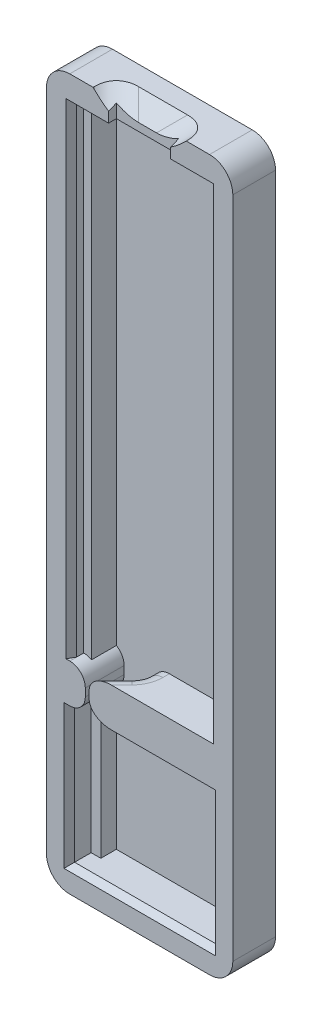
from build123d import *

# Parameters (mm, degrees)
BOSS_EXTRUDE1_DEPTH          = 5.5
SKETCH4_W                    = 16
SKETCH4_H                    = 62.5
SKETCH4_H_2                  = 18
CUT_EXTRUDE1_DEPTH           = 5
SKETCH5_W                    = 18.5
SKETCH5_H                    = 18
CUT_EXTRUDE2_DEPTH           = 3
SKETCH7_W                    = 18
SKETCH7_H                    = 62.5
CUT_EXTRUDE3_DEPTH           = 1.8
CUT_EXTRUDE4_START           = -1
SKETCH10_W                   = 8
SKETCH10_H                   = 1
CUT_EXTRUDE4_DEPTH           = 89.479047827
CUT_EXTRUDE4_TAPER           = -45
CUT_EXTRUDE4_OTHER_WAY_DEPTH = 1.8
FILLET1_R                    = 4
CHAMFER1_SIZE                = 0.5
CHAMFER1_SIZE2               = 0.866025404
CUT_EXTRUDE5_REACH           = 68.817
FILLET2_R                    = 2
FILLET3_R                    = 2


with BuildPart() as part:
    # Sketch2 → Boss-Extrude1 (new body)
    with BuildSketch(Plane.XY):
        with BuildLine():
            Line((-9, 75.5), (9, 75.5))
            ThreePointArc((9, 75.5), (11.121320344, 74.621320344), (12, 72.5))
            Line((12, 72.5), (12, -13))
            ThreePointArc((12, -13), (11.121320344, -15.121320344), (9, -16))
            Line((9, -16), (-9, -16))
            ThreePointArc((-9, -16), (-11.121320344, -15.121320344), (-12, -13))
            Line((-12, -13), (-12, 72.5))
            ThreePointArc((-12, 72.5), (-11.121320344, 74.621320344), (-9, 75.5))
        make_face()
    extrude(amount=BOSS_EXTRUDE1_DEPTH)

    # Sketch4 → Cut-Extrude1 (cut)
    with BuildSketch(Plane.XY.offset(5.5)):
        with Locations((0, 41.25)):
            Rectangle(SKETCH4_W, SKETCH4_H)
        with Locations((0, -4)):
            Rectangle(SKETCH4_W, SKETCH4_H_2)
    extrude(amount=-CUT_EXTRUDE1_DEPTH, mode=Mode.SUBTRACT)

    # Sketch5 → Cut-Extrude2 (cut)
    with BuildSketch(Plane.XY.offset(5.5)):
        with Locations((0, -4)):
            Rectangle(SKETCH5_W, SKETCH5_H)
    extrude(amount=-CUT_EXTRUDE2_DEPTH, mode=Mode.SUBTRACT)

    # Sketch7 → Cut-Extrude3 (cut)
    with BuildSketch(Plane.XY.offset(5.5)):
        with Locations((0, 41.25)):
            Rectangle(SKETCH7_W, SKETCH7_H)
    extrude(amount=-CUT_EXTRUDE3_DEPTH, mode=Mode.SUBTRACT)

    # Sketch10 → Cut-Extrude4 (cut)
    with BuildSketch(Plane.XZ.offset(-72.5).offset(CUT_EXTRUDE4_START)):
        with Locations((0, 5)):
            Rectangle(SKETCH10_W, SKETCH10_H)
    extrude(amount=-CUT_EXTRUDE4_DEPTH, taper=CUT_EXTRUDE4_TAPER, mode=Mode.SUBTRACT)

    # Sketch10 → Cut-Extrude4 other way (cut)
    with BuildSketch(Plane.XZ.offset(-72.5).offset(CUT_EXTRUDE4_START)):
        with Locations((0, 5)):
            Rectangle(SKETCH10_W, SKETCH10_H)
    extrude(amount=CUT_EXTRUDE4_OTHER_WAY_DEPTH, mode=Mode.SUBTRACT)

    # Fillet1
    # the kernel refuses this fillet: 4 mm, written as the material it adds along each edge
    with BuildSketch(Plane(origin=(0.666666667, 70.166666667, 7.833333333), x_dir=(0.4082482904638629, 0.40824829046386407, 0.8164965809277255), z_dir=(0.5773502691896267, 0.5773502691896242, -0.5773502691896265))) as fillet1_piece_1_section:
        with BuildLine():
            CenterArc((FILLET1_R * 0.57735026919, -FILLET1_R), FILLET1_R, 90, 60)
            Line((-FILLET1_R * 0.288675134595, -FILLET1_R * 0.5), (0, 0))
            Line((0, 0), (FILLET1_R * 0.57735026919, 0))
        make_face()
    fillet1_piece_1 = extrude(amount=15.011106999, mode=Mode.PRIVATE)
    fillet1_piece_1 = split(fillet1_piece_1, bisect_by=Plane(origin=(0.666666667, 75.5, 7.833333333), z_dir=(0, -1, 0)), keep=Keep.TOP, mode=Mode.PRIVATE)
    fillet1_piece_1 = split(fillet1_piece_1, bisect_by=Plane(origin=(4, 70.166666667, 7.833333333), z_dir=(-1, 0, 0)), keep=Keep.TOP, mode=Mode.PRIVATE)
    fillet1_piece_1 = split(fillet1_piece_1, bisect_by=Plane(origin=(0.666666667, 70.166666667, 4.5), z_dir=(0, 0, -1)), keep=Keep.TOP, mode=Mode.PRIVATE)
    add(fillet1_piece_1)
    with BuildSketch(Plane(origin=(0.666666667, 70.166666667, 7.833333333), x_dir=(0.4082482904638629, 0.40824829046386407, 0.8164965809277255), z_dir=(0.5773502691896267, 0.5773502691896242, -0.5773502691896265))) as fillet1_piece_2_section:
        with BuildLine():
            CenterArc((FILLET1_R * 0.57735026919, -FILLET1_R), FILLET1_R, 90, 60)
            Line((-FILLET1_R * 0.288675134595, -FILLET1_R * 0.5), (0, 0))
            Line((0, 0), (FILLET1_R * 0.57735026919, 0))
        make_face()
    fillet1_piece_2 = extrude(amount=15.011106999, mode=Mode.PRIVATE)
    fillet1_piece_2 = split(fillet1_piece_2, bisect_by=Plane(origin=(0.666666667, 75.5, 7.833333333), z_dir=(0, -1, 0)), keep=Keep.TOP, mode=Mode.PRIVATE)
    fillet1_piece_2 = split(fillet1_piece_2, bisect_by=Plane(origin=(0.666666667, 70.166666667, 5.5), z_dir=(0, 0, -1)), keep=Keep.TOP, mode=Mode.PRIVATE)
    fillet1_piece_2 = split(fillet1_piece_2, bisect_by=Plane(origin=(4, 70.166666667, 7.833333333), z_dir=(1, 0, 0)), keep=Keep.TOP, mode=Mode.PRIVATE)
    fillet1_piece_2 = split(fillet1_piece_2, bisect_by=Plane(origin=(0.666666667, 70.166666667, 4.5), z_dir=(0, 0, 1)), keep=Keep.TOP, mode=Mode.PRIVATE)
    add(fillet1_piece_2)
    with BuildSketch(Plane(origin=(0.666666667, 70.166666667, 7.833333333), x_dir=(0.4082482904638629, 0.40824829046386407, 0.8164965809277255), z_dir=(0.5773502691896267, 0.5773502691896242, -0.5773502691896265))) as fillet1_piece_3_section:
        with BuildLine():
            CenterArc((FILLET1_R * 0.57735026919, -FILLET1_R), FILLET1_R, 90, 60)
            Line((-FILLET1_R * 0.288675134595, -FILLET1_R * 0.5), (0, 0))
            Line((0, 0), (FILLET1_R * 0.57735026919, 0))
        make_face()
    fillet1_piece_3 = extrude(amount=15.011106999, mode=Mode.PRIVATE)
    fillet1_piece_3 = split(fillet1_piece_3, bisect_by=Plane(origin=(0.666666667, 75.5, 7.833333333), z_dir=(0, -1, 0)), keep=Keep.TOP, mode=Mode.PRIVATE)
    fillet1_piece_3 = split(fillet1_piece_3, bisect_by=Plane(origin=(4, 70.166666667, 7.833333333), z_dir=(1, 0, 0)), keep=Keep.TOP, mode=Mode.PRIVATE)
    fillet1_piece_3 = split(fillet1_piece_3, bisect_by=Plane(origin=(0.666666667, 70.166666667, 4.5), z_dir=(0, 0, -1)), keep=Keep.TOP, mode=Mode.PRIVATE)
    add(fillet1_piece_3)
    with BuildSketch(Plane(origin=(-0.666666667, 70.166666667, 7.833333333), x_dir=(0.8164965809277253, 0.40824829046386424, -0.4082482904638631), z_dir=(-0.5773502691896267, 0.5773502691896242, -0.5773502691896265))) as fillet1_piece_4_section:
        with BuildLine():
            CenterArc((FILLET1_R * 0.57735026919, -FILLET1_R), FILLET1_R, 90, 60)
            Line((-FILLET1_R * 0.288675134595, -FILLET1_R * 0.5), (0, 0))
            Line((0, 0), (FILLET1_R * 0.57735026919, 0))
        make_face()
    fillet1_piece_4 = extrude(amount=15.011106999, mode=Mode.PRIVATE)
    fillet1_piece_4 = split(fillet1_piece_4, bisect_by=Plane(origin=(-0.666666667, 75.5, 7.833333333), z_dir=(0, -1, 0)), keep=Keep.TOP, mode=Mode.PRIVATE)
    fillet1_piece_4 = split(fillet1_piece_4, bisect_by=Plane(origin=(-0.666666667, 70.166666667, 5.5), z_dir=(0, 0, -1)), keep=Keep.TOP, mode=Mode.PRIVATE)
    fillet1_piece_4 = split(fillet1_piece_4, bisect_by=Plane(origin=(-0.666666667, 70.166666667, 4.5), z_dir=(0, 0, 1)), keep=Keep.TOP, mode=Mode.PRIVATE)
    fillet1_piece_4 = split(fillet1_piece_4, bisect_by=Plane(origin=(-4, 70.166666667, 7.833333333), z_dir=(-1, 0, 0)), keep=Keep.TOP, mode=Mode.PRIVATE)
    add(fillet1_piece_4)
    with BuildSketch(Plane(origin=(-0.666666667, 70.166666667, 7.833333333), x_dir=(0.8164965809277253, 0.40824829046386424, -0.4082482904638631), z_dir=(-0.5773502691896267, 0.5773502691896242, -0.5773502691896265))) as fillet1_piece_5_section:
        with BuildLine():
            CenterArc((FILLET1_R * 0.57735026919, -FILLET1_R), FILLET1_R, 90, 60)
            Line((-FILLET1_R * 0.288675134595, -FILLET1_R * 0.5), (0, 0))
            Line((0, 0), (FILLET1_R * 0.57735026919, 0))
        make_face()
    fillet1_piece_5 = extrude(amount=15.011106999, mode=Mode.PRIVATE)
    fillet1_piece_5 = split(fillet1_piece_5, bisect_by=Plane(origin=(-0.666666667, 75.5, 7.833333333), z_dir=(0, -1, 0)), keep=Keep.TOP, mode=Mode.PRIVATE)
    fillet1_piece_5 = split(fillet1_piece_5, bisect_by=Plane(origin=(-0.666666667, 70.166666667, 4.5), z_dir=(0, 0, -1)), keep=Keep.TOP, mode=Mode.PRIVATE)
    fillet1_piece_5 = split(fillet1_piece_5, bisect_by=Plane(origin=(-4, 70.166666667, 7.833333333), z_dir=(1, 0, 0)), keep=Keep.TOP, mode=Mode.PRIVATE)
    add(fillet1_piece_5)
    with BuildSketch(Plane(origin=(-0.666666667, 70.166666667, 7.833333333), x_dir=(0.8164965809277253, 0.40824829046386424, -0.4082482904638631), z_dir=(-0.5773502691896267, 0.5773502691896242, -0.5773502691896265))) as fillet1_piece_6_section:
        with BuildLine():
            CenterArc((FILLET1_R * 0.57735026919, -FILLET1_R), FILLET1_R, 90, 60)
            Line((-FILLET1_R * 0.288675134595, -FILLET1_R * 0.5), (0, 0))
            Line((0, 0), (FILLET1_R * 0.57735026919, 0))
        make_face()
    fillet1_piece_6 = extrude(amount=15.011106999, mode=Mode.PRIVATE)
    fillet1_piece_6 = split(fillet1_piece_6, bisect_by=Plane(origin=(-0.666666667, 75.5, 7.833333333), z_dir=(0, -1, 0)), keep=Keep.TOP, mode=Mode.PRIVATE)
    fillet1_piece_6 = split(fillet1_piece_6, bisect_by=Plane(origin=(-0.666666667, 70.166666667, 4.5), z_dir=(0, 0, -1)), keep=Keep.TOP, mode=Mode.PRIVATE)
    fillet1_piece_6 = split(fillet1_piece_6, bisect_by=Plane(origin=(-4, 70.166666667, 7.833333333), z_dir=(-1, 0, 0)), keep=Keep.TOP, mode=Mode.PRIVATE)
    add(fillet1_piece_6)

    # Chamfer1
    chamfer1_edges = [part.edges().sort_by_distance(p)[0] for p in [
        (0, -13, 5.5),
        (-9.25, -4, 5.5),
        (9.25, -4, 5.5),
        (-9, 41.25, 5.5),
        (9, 41.25, 5.5),
    ]]
    chamfer1_side = [part.faces().sort_by_distance(p)[0] for p in [
        (-5.551441315, 73.803006174, 5.5),
    ]]
    chamfer(chamfer1_edges, length=CHAMFER1_SIZE, length2=CHAMFER1_SIZE2, reference=chamfer1_side[0])

    # Sketch11 → Cut-Extrude5 (cut, up to next)
    with BuildSketch(Plane(origin=(0, 10, 0), x_dir=(1, 0, 0), z_dir=(0, 1, 0)), mode=Mode.PRIVATE) as cut_extrude5_sk1:
        with BuildLine():
            Line((-7, -5.5), (-7, -0.5))
            Line((-7, -0.5), (-3.169880661, -0.5))
            Line((-3.169880661, -0.5), (-3.169880661, -1.341453537))
            ThreePointArc((-3.169880661, -1.341453537), (-3.322121596, -2.106820401), (-3.755667099, -2.755667099))
            Line((-3.755667099, -2.755667099), (-6.5, -5.5))
            Line((-6.5, -5.5), (-7, -5.5))
        make_face()
    cut_extrude5_tool1 = extrude(cut_extrude5_sk1.sketch, amount=-CUT_EXTRUDE5_REACH, mode=Mode.PRIVATE) & part.part
    add(cut_extrude5_tool1.solids().sort_by_distance((-5.426528, 10, 2.435535))[0], mode=Mode.SUBTRACT)

    # Fillet2
    fillet2_edges = [part.edges().sort_by_distance(p)[0] for p in [
        (-3.169880661, 5, 0.920726768),
        (-3.322121596, 5, 2.106820401),
        (-5.12783355, 5, 4.12783355),
        (-5.12783355, 10, 4.12783355),
        (-3.322121596, 10, 2.106820401),
        (-3.169880661, 10, 0.920726768),
    ]]
    fillet(fillet2_edges, radius=FILLET2_R)

    # Fillet3
    fillet3_edges = [part.edges().sort_by_distance(p)[0] for p in [
        (-7, 10, 3),
        (-7, 5, 3),
    ]]
    fillet(fillet3_edges, radius=FILLET3_R)


solid = part.part
